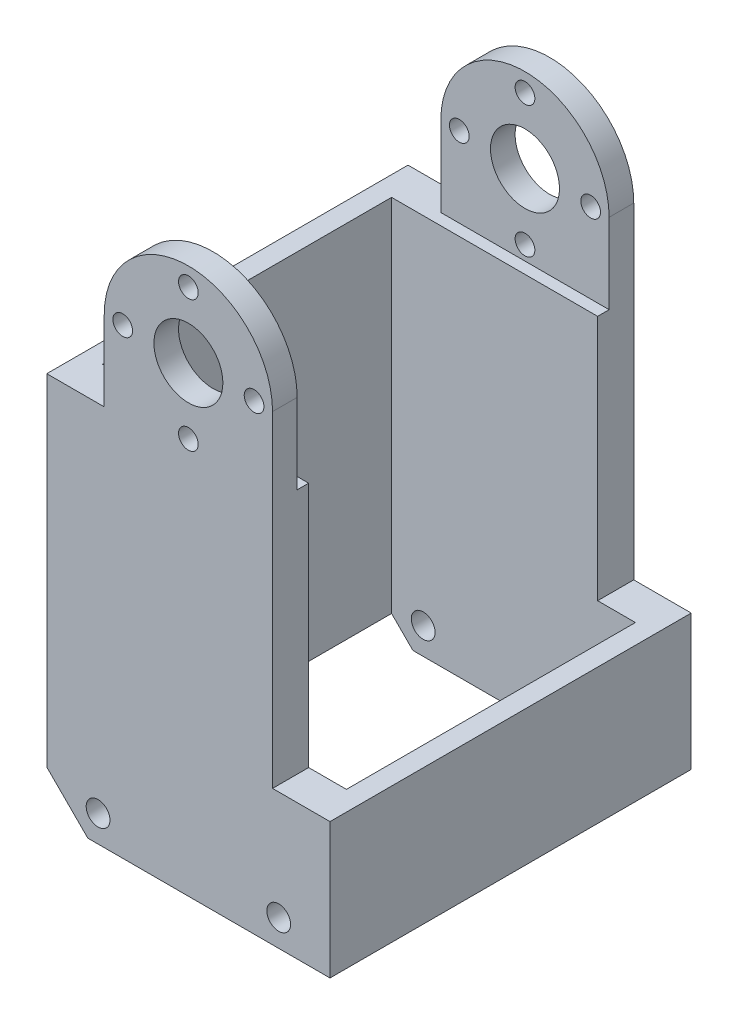
from build123d import *

# Parameters (mm, degrees)
BOSS_EXTRUDE1_DEPTH      = 22
BOSS_EXTRUDE1_DEPTH_BACK = 22
SKETCH2_W                = 38
SKETCH2_H                = 20
CUT_EXTRUDE1_DEPTH       = 105.423416914
SKETCH3_W                = 7
SKETCH3_H                = 44
BOSS_EXTRUDE2_DEPTH      = 65.5
SKETCH23_R               = 5
SKETCH23_R_2             = 1.2
CUT_EXTRUDE2_DEPTH       = 111.605436123
SKETCH24_W               = 28.5
SKETCH24_H               = 34
CUT_EXTRUDE3_DEPTH       = 90.954502389
SKETCH26_R               = 1.2
SKETCH26_R_2             = 5
SKETCH26_R_3             = 1.45
CUT_EXTRUDE6_DEPTH       = 107.330263801
SKETCH27_W               = 29.7
SKETCH27_H               = 35.2
CUT_EXTRUDE8_DEPTH       = 73.137455597
SKETCH29_W               = 7
SKETCH29_H               = 30
CUT_EXTRUDE10_DEPTH      = 74.468530678
CHAMFER2_SIZE            = 5


with BuildPart() as part:
    # Sketch1 → Boss-Extrude1 (new, two sides: drawn at the far end of the back side and taken through both)
    with BuildSketch(Plane.XY.offset(-BOSS_EXTRUDE1_DEPTH_BACK)):
        with BuildLine():
            Line((10.25, -60), (10.25, 0))
            ThreePointArc((10.25, 0), (0, -10.25), (-10.25, 0))
            Line((-10.25, 0), (-10.25, -60))
            Line((-10.25, -60), (-10.25, -100))
            Line((-10.25, -100), (10.25, -100))
            Line((10.25, -100), (10.25, -60))
        make_face()
        with BuildLine():
            Line((10.25, 0), (9.2, 0))
            ThreePointArc((9.2, 0), (8.816088231, -0.879772698), (7.91, -1.196620241))
            ThreePointArc((7.91, -1.196620241), (5.656854249, -5.656854249), (1.196620241, -7.91))
            ThreePointArc((1.196620241, -7.91), (1.199154762, -7.954968281), (1.2, -8))
            ThreePointArc((1.2, -8), (-0.045031719, -9.199154762), (-1.196620241, -7.91))
            ThreePointArc((-1.196620241, -7.91), (-5.656854249, -5.656854249), (-7.91, -1.196620241))
            ThreePointArc((-7.91, -1.196620241), (-8.816088231, -0.879772698), (-9.2, 0))
            Line((-9.2, 0), (-10.25, 0))
            ThreePointArc((-10.25, 0), (0, -10.25), (10.25, 0))
        make_face()
        with BuildLine():
            ThreePointArc((7.91, -1.196620241), (7.120227302, -0.816088231), (6.8, 0))
            Line((6.8, 0), (4.2, 0))
            ThreePointArc((4.2, 0), (0, -4.2), (-4.2, 0))
            Line((-4.2, 0), (-6.8, 0))
            ThreePointArc((-6.8, 0), (-7.120227302, -0.816088231), (-7.91, -1.196620241))
            ThreePointArc((-7.91, -1.196620241), (-5.656854249, -5.656854249), (-1.196620241, -7.91))
            ThreePointArc((-1.196620241, -7.91), (0, -6.8), (1.196620241, -7.91))
            ThreePointArc((1.196620241, -7.91), (5.656854249, -5.656854249), (7.91, -1.196620241))
        make_face()
        with BuildLine():
            Line((4.2, 0), (6.8, 0))
            ThreePointArc((6.8, 0), (7.120227302, 0.816088231), (7.91, 1.196620241))
            ThreePointArc((7.91, 1.196620241), (5.656854249, 5.656854249), (1.196620241, 7.91))
            ThreePointArc((1.196620241, 7.91), (0, 6.8), (-1.196620241, 7.91))
            ThreePointArc((-1.196620241, 7.91), (-5.656854249, 5.656854249), (-7.91, 1.196620241))
            ThreePointArc((-7.91, 1.196620241), (-7.120227302, 0.816088231), (-6.8, 0))
            Line((-6.8, 0), (-4.2, 0))
            ThreePointArc((-4.2, 0), (0, 4.2), (4.2, 0))
        make_face()
        with BuildLine():
            ThreePointArc((7.91, 1.196620241), (8.816088231, 0.879772698), (9.2, 0))
            Line((9.2, 0), (10.25, 0))
            ThreePointArc((10.25, 0), (0, 10.25), (-10.25, 0))
            Line((-10.25, 0), (-9.2, 0))
            ThreePointArc((-9.2, 0), (-8.816088231, 0.879772698), (-7.91, 1.196620241))
            ThreePointArc((-7.91, 1.196620241), (-5.656854249, 5.656854249), (-1.196620241, 7.91))
            ThreePointArc((-1.196620241, 7.91), (-0.045031719, 9.199154762), (1.2, 8))
            ThreePointArc((1.2, 8), (1.199154762, 7.954968281), (1.196620241, 7.91))
            ThreePointArc((1.196620241, 7.91), (5.656854249, 5.656854249), (7.91, 1.196620241))
        make_face()
    extrude(amount=BOSS_EXTRUDE1_DEPTH + BOSS_EXTRUDE1_DEPTH_BACK)

    # Sketch2 → Cut-Extrude1 (cut, through all)
    with BuildSketch(Plane.ZY.offset(10.25)):
        with Locations((0, 0.25)):
            Rectangle(SKETCH2_W, SKETCH2_H)
    extrude(amount=-CUT_EXTRUDE1_DEPTH, mode=Mode.SUBTRACT)

    # Sketch3 → Boss-Extrude2 (add)
    with BuildSketch(Plane(origin=(0, -9.75, 0), x_dir=(1, 0, 0), z_dir=(0, 1, 0))):
        with Locations((-13.75, 0)):
            Rectangle(SKETCH3_W, SKETCH3_H)
        with Locations((13.75, 0)):
            Rectangle(SKETCH3_W, SKETCH3_H)
    extrude(amount=-BOSS_EXTRUDE2_DEPTH)

    # Sketch23 → Cut-Extrude2 (cut, through all)
    with BuildSketch(Plane.XY.offset(22)):
        with BuildLine():
            Line((-10.25, -100), (10.25, -100))
            Line((10.25, -100), (10.25, -85))
            ThreePointArc((10.25, -85), (0, -95.25), (-10.25, -85))
            Line((-10.25, -85), (-10.25, -100))
        make_face()
        with Locations((0, -85)):
            Circle(SKETCH23_R)
        with Locations((8, -85)):
            Circle(SKETCH23_R_2)
        with Locations((0, -77)):
            Circle(SKETCH23_R_2)
        with Locations((0, -93)):
            Circle(SKETCH23_R_2)
        with Locations((-8, -85)):
            Circle(SKETCH23_R_2)
    extrude(amount=-CUT_EXTRUDE2_DEPTH, mode=Mode.SUBTRACT)

    # Sketch24 → Cut-Extrude3 (cut, through all)
    with BuildSketch(Plane(origin=(0, -9.75, 0), x_dir=(1, 0, 0), z_dir=(0, 1, 0))):
        Rectangle(SKETCH24_W, SKETCH24_H)
    extrude(amount=-CUT_EXTRUDE3_DEPTH, mode=Mode.SUBTRACT)

    # Sketch26 → Cut-Extrude6 (cut, through all)
    # profile 1 of 5: a face of its own
    with BuildSketch(Plane.XY.offset(22)):
        with BuildLine():
            Line((10.25, -75.25), (14.25, -75.25))
            Line((14.25, -75.25), (14.25, -56.53282359))
            Line((14.25, -56.53282359), (14.25, -56.25))
            Line((14.25, -56.25), (-14.25, -56.25))
            Line((-14.25, -56.25), (-14.25, -56.53282359))
            Line((-14.25, -56.53282359), (-14.25, -75.25))
            Line((-14.25, -75.25), (-10.25, -75.25))
            Line((-10.25, -75.25), (-10.25, -85))
            ThreePointArc((-10.25, -85), (0, -95.25), (10.25, -85))
            Line((10.25, -85), (10.25, -75.25))
        make_face()
        with Locations((-8, -85)):
            Circle(SKETCH26_R, mode=Mode.SUBTRACT)
        with Locations((0, -85)):
            Circle(SKETCH26_R_2, mode=Mode.SUBTRACT)
        with Locations((0, -77)):
            Circle(SKETCH26_R, mode=Mode.SUBTRACT)
        with Locations((0, -93)):
            Circle(SKETCH26_R, mode=Mode.SUBTRACT)
        with Locations((8, -85)):
            Circle(SKETCH26_R, mode=Mode.SUBTRACT)
    # profile 2 of 5: a face of its own
    with BuildSketch(Plane.XY.offset(22)):
        Polygon((-17.25, -75.25), (-14.25, -75.25), (-14.25, -56.53282359), (-14.25, -56.25), (-17.25, -56.25), align=None)
    # profile 3 of 5: a face of its own
    with BuildSketch(Plane.XY.offset(22)):
        Polygon((14.25, -56.53282359), (14.25, -75.25), (17.25, -75.25), (17.25, -56.25), (14.25, -56.25), align=None)
    # profile 4 of 5: a face of its own
    with BuildSketch(Plane.XY.offset(22)):
        with Locations((-11, -53)):
            Circle(SKETCH26_R_3)
    # profile 5 of 5: a face of its own
    with BuildSketch(Plane.XY.offset(22)):
        with Locations((11, -53)):
            Circle(SKETCH26_R_3)
    extrude(amount=-CUT_EXTRUDE6_DEPTH, mode=Mode.SUBTRACT)

    # Sketch27 → Cut-Extrude8 (cut, through all)
    with BuildSketch(Plane.XZ.offset(56.25)):
        Rectangle(SKETCH27_W, SKETCH27_H)
    extrude(amount=-CUT_EXTRUDE8_DEPTH, mode=Mode.SUBTRACT)

    # Sketch29 → Cut-Extrude10 (cut, through all)
    with BuildSketch(Plane(origin=(0, 0, -22), x_dir=(-1, 0, 0), z_dir=(0, 0, -1))):
        with Locations((-13.75, -24.75)):
            Rectangle(SKETCH29_W, SKETCH29_H)
    extrude(amount=-CUT_EXTRUDE10_DEPTH, mode=Mode.SUBTRACT)

    # Chamfer2
    # the kernel refuses this chamfer: 5 mm, written as the material it takes off along each edge
    with BuildSketch(Plane(origin=(-17.25, -56.25, 34.85841494), x_dir=(0.9996219169112968, -0.027495876610586327, 0), z_dir=(0, 0, -1))) as chamfer2_piece_1:
        Polygon((CHAMFER2_SIZE * 0.999621916911, -CHAMFER2_SIZE * 0.0274958766106), (-CHAMFER2_SIZE * 0.0274958766106, -CHAMFER2_SIZE * 0.999621916911), (0, 0), align=None)
    extrude(amount=69.71682988, mode=Mode.SUBTRACT)


solid = part.part
